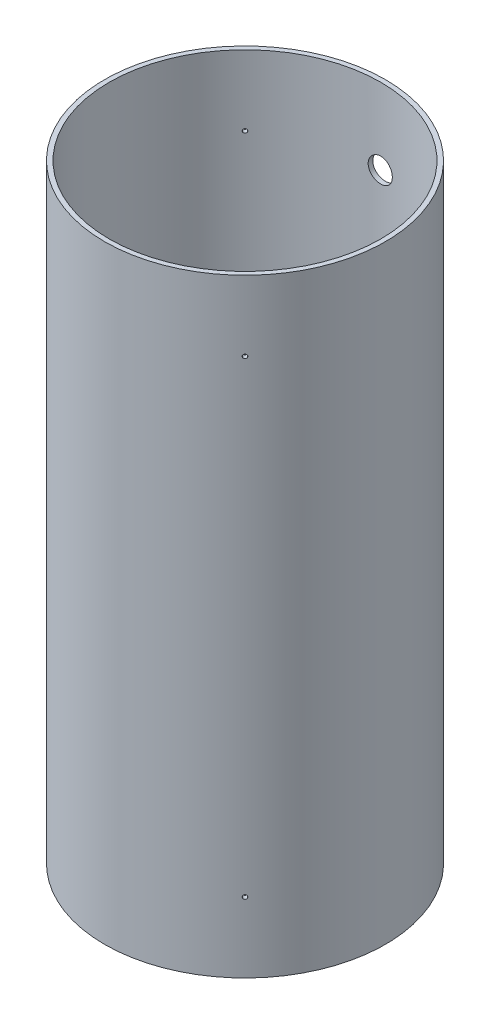
from build123d import *

# Parameters (mm, degrees)
SKETCH1_R           = 76.1746
SKETCH1_R_2         = 73.66
BOSS_EXTRUDE1_DEPTH = 330.2
SKETCH23_R          = 1.0922
SHEAR_SCRREWS_DEPTH = 348.328633238
CIRPATTERN1_COUNT   = 4


with BuildPart() as part:
    # Sketch1 → Boss-Extrude1 (new body)
    with BuildSketch(Plane(origin=(0, 0, 0), x_dir=(1, 0, 0), z_dir=(0, 1, 0))):
        Circle(SKETCH1_R)
        Circle(SKETCH1_R_2, mode=Mode.SUBTRACT)
    extrude(amount=BOSS_EXTRUDE1_DEPTH)

    # Sketch17 → 1/2 Clearance Hole5 (revolve, cut)
    with BuildSketch(Plane(origin=(0, 288.925, 0), x_dir=(0, -1, 0), z_dir=(1, 0, 0))):
        Polygon((0, 0), (0, 80.134507437), (6.54812, 76.2), (6.54812, 0), align=None)
    revolve(axis=Axis((0, 288.925, 6.35), (0, 0, -1)), mode=Mode.SUBTRACT)

    # Sketch21 → 1/2 Clearance Hole7 (revolve, cut)
    with BuildSketch(Plane(origin=(0, 41.275, 0), x_dir=(0, -1, 0), z_dir=(1, 0, 0))):
        Polygon((0, 0), (0, 80.134507437), (6.54812, 76.2), (6.54812, 0), align=None)
    revolve(axis=Axis((0, 41.275, 6.35), (0, 0, -1)), mode=Mode.SUBTRACT)

    # Sketch23 → Shear Scrrews (cut, through all)
    with BuildSketch(Plane(origin=(0, 0, 0), x_dir=(0.7071067811865477, 0, 0.7071067811865475), z_dir=(-0.7071067811865475, 0, 0.7071067811865477))):
        with Locations((0, 292.1)):
            Circle(SKETCH23_R)
        with Locations((0, 38.1)):
            Circle(SKETCH23_R)
    shear_scrrews = extrude(amount=-SHEAR_SCRREWS_DEPTH, mode=Mode.SUBTRACT)

    # CirPattern1: Shear Scrrews ×4 about axis
    cirpattern1_axis = Axis((0, 330.2, 0), (0, -1, 0))
    for i in range(1, CIRPATTERN1_COUNT):
        add(shear_scrrews.rotate(cirpattern1_axis, i * 360 / CIRPATTERN1_COUNT), mode=Mode.SUBTRACT)


solid = part.part
